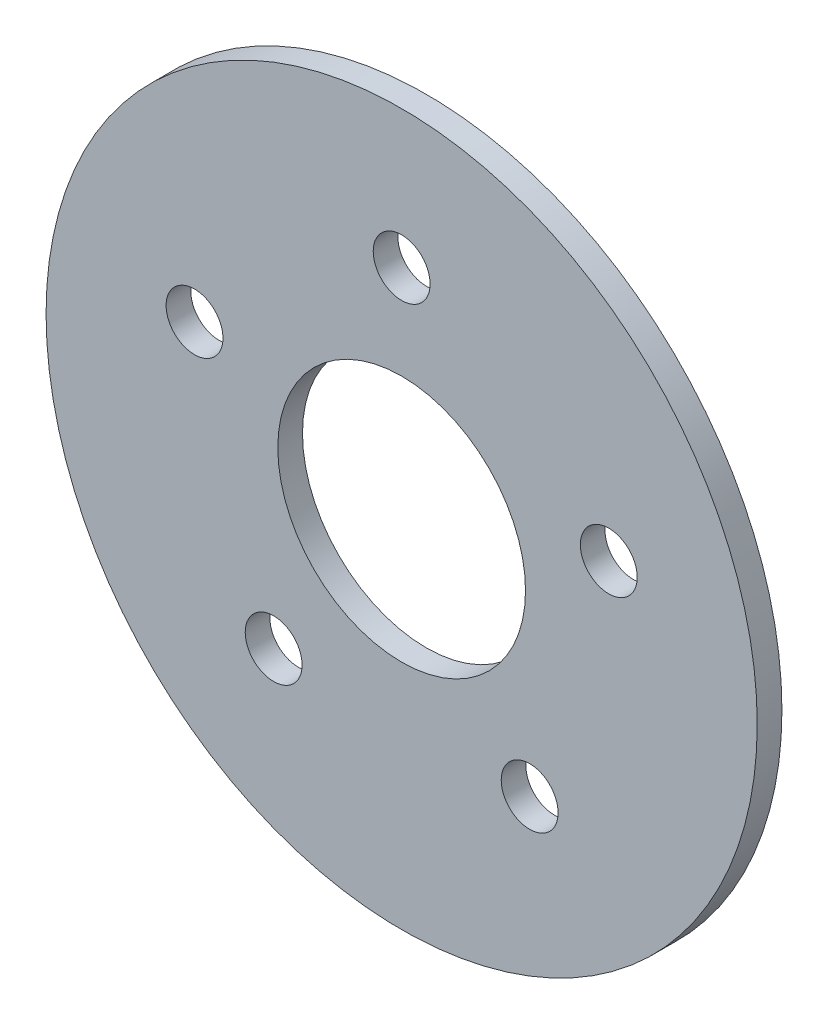
from build123d import *

# Parameters (mm, degrees)
SKETCH1_R           = 22.86
SKETCH1_R_2         = 7.9629
SKETCH1_R_3         = 1.8288
BOSS_EXTRUDE1_DEPTH = 1.5875


with BuildPart() as part:
    # Sketch1 → Boss-Extrude1 (new body)
    with BuildSketch(Plane(origin=(0, 0, -15.24), x_dir=(-1, 0, 0), z_dir=(0, 0, -1))):
        Circle(SKETCH1_R)
        Circle(SKETCH1_R_2, mode=Mode.SUBTRACT)
        with Locations((13.314791228, 4.326237921)):
            Circle(SKETCH1_R_3, mode=Mode.SUBTRACT)
        with Locations((8.228993532, -11.326237921)):
            Circle(SKETCH1_R_3, mode=Mode.SUBTRACT)
        with Locations((-8.228993532, -11.326237921)):
            Circle(SKETCH1_R_3, mode=Mode.SUBTRACT)
        with Locations((-13.314791228, 4.326237921)):
            Circle(SKETCH1_R_3, mode=Mode.SUBTRACT)
        with Locations((0, 14)):
            Circle(SKETCH1_R_3, mode=Mode.SUBTRACT)
    extrude(amount=BOSS_EXTRUDE1_DEPTH)


solid = part.part
